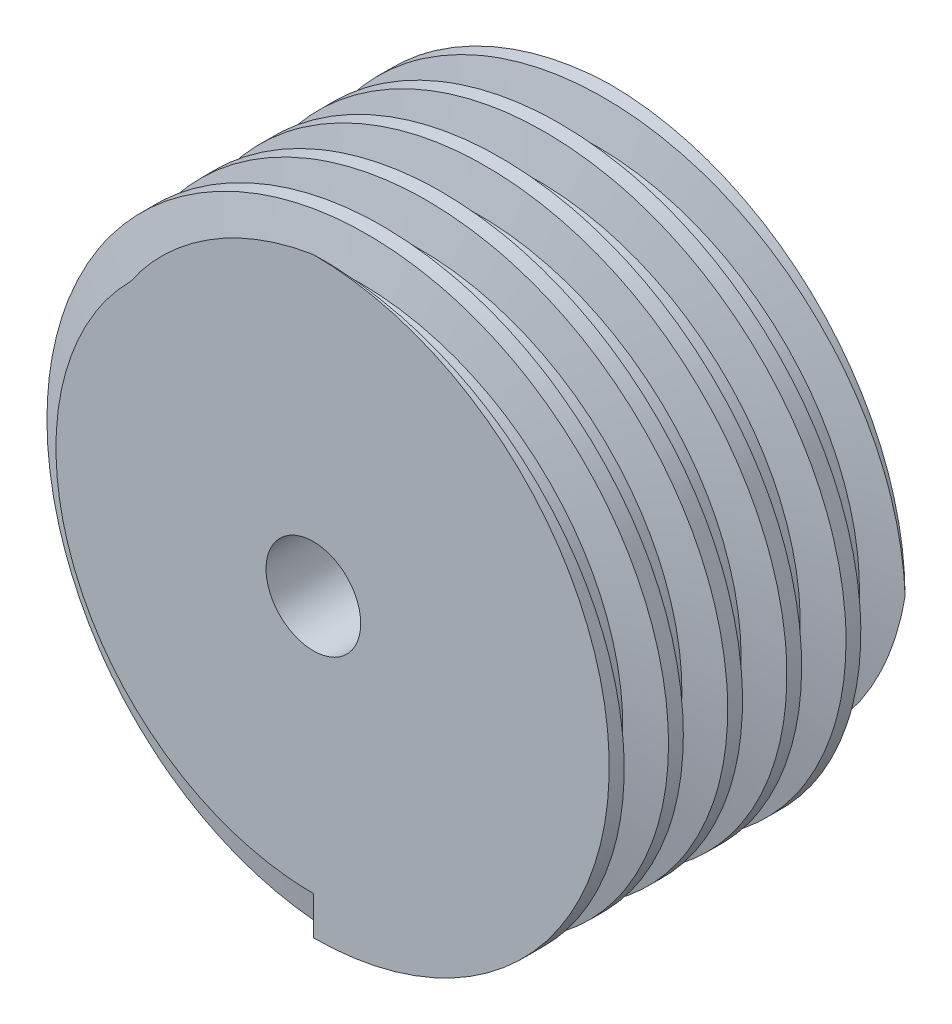
from build123d import *

# Parameters (mm, degrees)
SKETCH_1_R          = 10
EXTRUDE_1_DEPTH     = 10
SWEEP_3_PITCH       = 2
SKETCH_12_R         = 1.6
CUT_EXTRUDE_2_DEPTH = 11.5


with BuildPart() as part:
    # 草圖1 → 填料-伸長1 (new body)
    with BuildSketch(Plane.XY):
        Circle(SKETCH_1_R)
    extrude(amount=EXTRUDE_1_DEPTH)

    # 除料-掃出3: the profile of 草圖10 screwed along a right-hand helix of 5.5 turns, 10 arcs to a turn; built about Z, then put on its axis
    sweep_3_z = Axis((0, 0, 0), (0, 0, 1))
    sweep_3_corners = [(8.702627851, 0, -0.25), (8.702627851, 0, -1.25), (10.002627851, 0, -1.5), (10.002627851, 0, 0)]
    with BuildLine(mode=Mode.PRIVATE) as sweep_3_profile:
        Line(sweep_3_corners[0], sweep_3_corners[1])
        Line(sweep_3_corners[1], sweep_3_corners[2])
        Line(sweep_3_corners[2], sweep_3_corners[3])
        Line(sweep_3_corners[3], sweep_3_corners[0])
    sweep_3_cap = Face(sweep_3_profile.wire())
    sweep_3_turn_angles = [0, 18, 36, 54, 72, 90, 108, 126, 144, 162, 180, 198, 216, 234, 252, 270, 288, 306, 324, 342, 360]
    sweep_3_turn_weights = [1, 0.9510565162951535, 1, 0.9510565162951535, 1, 0.9510565162951535, 1, 0.9510565162951535, 1, 0.9510565162951535, 1, 0.9510565162951535, 1, 0.9510565162951535, 1, 0.9510565162951535, 1, 0.9510565162951535, 1, 0.9510565162951535, 1]
    sweep_3_turn_rails = [Edge.make_bspline([Vector(p[0], p[1], 0).rotate(sweep_3_z, sweep_3_turn_angles[k]) / sweep_3_turn_weights[k] + Vector(0, 0, p[2] + SWEEP_3_PITCH * sweep_3_turn_angles[k] / 360) for k in range(21)], [0, 0, 0, 1, 1, 2, 2, 3, 3, 4, 4, 5, 5, 6, 6, 7, 7, 8, 8, 9, 9, 10, 10, 10], 2, sweep_3_turn_weights) for p in sweep_3_corners]
    sweep_3_turn_sides = [Face.make_surface_from_curves(sweep_3_turn_rails[p[0]], sweep_3_turn_rails[p[1]]) for p in [(0, 1), (1, 2), (2, 3), (3, 0)]]
    sweep_3_last_angles = [1800, 1818, 1836, 1854, 1872, 1890, 1908, 1926, 1944, 1962, 1980]
    sweep_3_last_weights = [1, 0.9510565162951535, 1, 0.9510565162951535, 1, 0.9510565162951535, 1, 0.9510565162951535, 1, 0.9510565162951382, 1]
    sweep_3_last_rails = [Edge.make_bspline([Vector(p[0], p[1], 0).rotate(sweep_3_z, sweep_3_last_angles[k]) / sweep_3_last_weights[k] + Vector(0, 0, p[2] + SWEEP_3_PITCH * sweep_3_last_angles[k] / 360) for k in range(11)], [0, 0, 0, 1, 1, 2, 2, 3, 3, 4, 4, 5, 5, 5], 2, sweep_3_last_weights) for p in sweep_3_corners]
    sweep_3_last_sides = [Face.make_surface_from_curves(sweep_3_last_rails[p[0]], sweep_3_last_rails[p[1]]) for p in [(0, 1), (1, 2), (2, 3), (3, 0)]]
    sweep_3 = Plane(origin=(0, 0, 0), x_dir=(0, 1, 0), z_dir=(0, 0, 1)) * Solid(Shell([*[p.moved(Location((0, 0, SWEEP_3_PITCH * i))) for i in range(5) for p in sweep_3_turn_sides], *sweep_3_last_sides, sweep_3_cap, sweep_3_cap.rotate(sweep_3_z, 1980).moved(Location((0, 0, SWEEP_3_PITCH * 1980 / 360)))]))
    add(sweep_3, mode=Mode.SUBTRACT)

    # 草圖12 → 除料-伸長2 (cut)
    with BuildSketch(Plane.XY.offset(10)):
        Circle(SKETCH_12_R)
    extrude(amount=-CUT_EXTRUDE_2_DEPTH, mode=Mode.SUBTRACT)


solid = part.part
